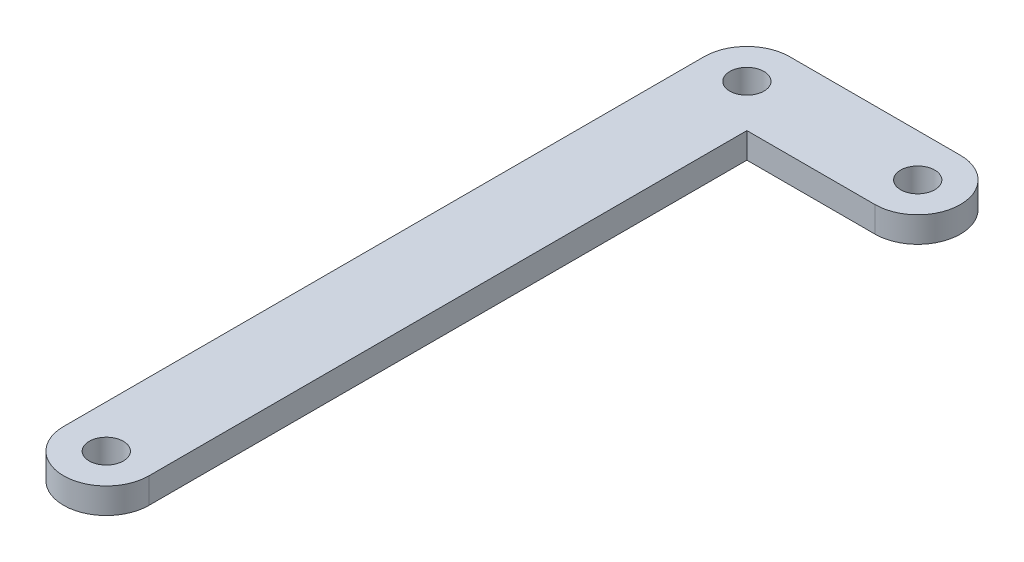
from build123d import *

# Parameters (mm, degrees)
SKETCH1_R           = 2
BOSS_EXTRUDE1_DEPTH = 3


with BuildPart() as part:
    # Sketch1 → Boss-Extrude1 (new body)
    with BuildSketch(Plane(origin=(0, 0, 0), x_dir=(1, 0, 0), z_dir=(0, 1, 0))):
        with BuildLine():
            Line((19.068769591, 26.574235382), (19.068769591, -48.425764618))
            ThreePointArc((19.068769591, -48.425764618), (24.068769591, -53.425764618), (29.068769591, -48.425764618))
            Line((29.068769591, -48.425764618), (29.068769591, 21.574235382))
            Line((29.068769591, 21.574235382), (44.068769591, 21.574235382))
            ThreePointArc((44.068769591, 21.574235382), (49.068769591, 26.574235382), (44.068769591, 31.574235382))
            Line((44.068769591, 31.574235382), (24.068769591, 31.574235382))
            ThreePointArc((24.068769591, 31.574235382), (20.533235685, 30.109769288), (19.068769591, 26.574235382))
        make_face()
        with Locations((24.068769591, 26.574235382)):
            Circle(SKETCH1_R, mode=Mode.SUBTRACT)
        with Locations((24.068769591, -48.425764618)):
            Circle(SKETCH1_R, mode=Mode.SUBTRACT)
        with Locations((44.068769591, 26.574235382)):
            Circle(SKETCH1_R, mode=Mode.SUBTRACT)
    extrude(amount=BOSS_EXTRUDE1_DEPTH)


solid = part.part
